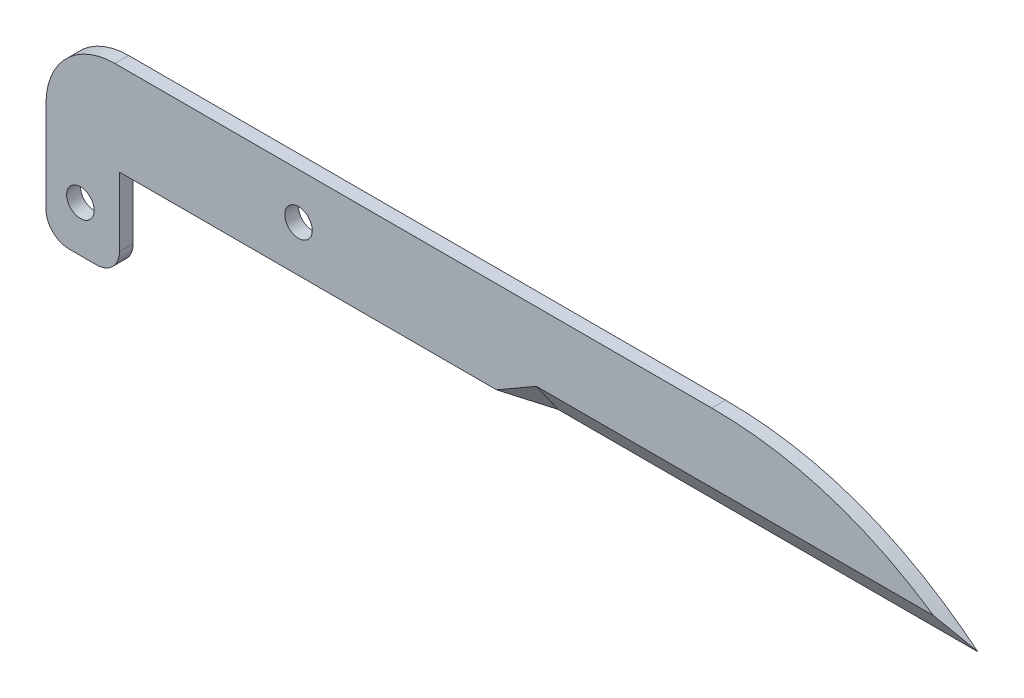
from build123d import *

# Parameters (mm, degrees)
SKETCH_1_W          = 200
SKETCH_1_H          = 20
EXTRUDE_1_DEPTH     = 3
CUT_EXTRUDE_1_REACH = 202.272
CHAMFER_1_SIZE      = 4
CHAMFER_1_SIZE_2    = 6.92820323
CUT_EXTRUDE_2_DEPTH = 101.543522914
SKETCH_5_R          = 3
CUT_EXTRUDE_3_DEPTH = 4
SKETCH_8_W          = 16
SKETCH_8_H          = 20
EXTRUDE_2_DEPTH     = 3
SKETCH_7_R          = 3
CUT_EXTRUDE_5_DEPTH = 10
FILLET_1_R          = 15
FILLET_2_R          = 5


with BuildPart() as part:
    # 草图1 → 凸台-拉伸1 (new body)
    with BuildSketch(Plane.XY):
        Rectangle(SKETCH_1_W, SKETCH_1_H)
    extrude(amount=EXTRUDE_1_DEPTH)

    # 切除-拉伸1: up to this plane
    cut_extrude_1_end = Plane(origin=(7.330127019, -12.696152423, 0), z_dir=(-0.49999999999999445, 0.8660254037844419, 0))
    # 草图3 → 切除-拉伸1 (cut, up to the surface)
    with BuildSketch(Plane(origin=(100, 0, 0), x_dir=(0, 0, -1), z_dir=(1, 0, 0)), mode=Mode.PRIVATE) as cut_extrude_1_sk1:
        Polygon((-3, -5), (0, -10), (-3, -10), align=None)
    cut_extrude_1_tool1 = split(extrude(cut_extrude_1_sk1.sketch, amount=-CUT_EXTRUDE_1_REACH, mode=Mode.PRIVATE), bisect_by=cut_extrude_1_end, keep=Keep.BOTH, mode=Mode.PRIVATE)
    add(cut_extrude_1_tool1.solids().sort_by_distance((100, -8.333333, 2))[0], mode=Mode.SUBTRACT)

    # 倒角1
    # the kernel refuses this chamfer: 6.92820323, 4 mm, written as the material it takes off along each edge
    with BuildSketch(Plane(origin=(-3.522514528, -18.961927941, 3), x_dir=(0.02894693120133512, -0.05013755556391397, -0.9983227437537926), z_dir=(0.8660254037844419, 0.49999999999999445, 0))) as chamfer_1_piece_1_section:
        Polygon((CHAMFER_1_SIZE * 0.998322743754, CHAMFER_1_SIZE * 0.0578938624027), (-CHAMFER_1_SIZE_2 * 0.057893862405, CHAMFER_1_SIZE_2 * 0.998322743793), (0, 0), align=None)
    chamfer_1_piece_1 = extrude(amount=45.847711765, mode=Mode.PRIVATE)
    chamfer_1_piece_1 = split(chamfer_1_piece_1, bisect_by=Plane(origin=(9.642486401, -7.716503268, 1.370098039), z_dir=(0, -0.5144957554275265, 0.8574929257125443)), keep=Keep.TOP, mode=Mode.PRIVATE)
    add(chamfer_1_piece_1, mode=Mode.SUBTRACT)

    # 草图4 → 切除-拉伸2 (cut, through all)
    with BuildSketch(Plane.XY.offset(3)):
        with BuildLine():
            Line((45, 10), (45, 14.118329336))
            Line((45, 14.118329336), (100, 14.118329336))
            Line((100, 14.118329336), (100, -10))
            add(Edge.make_bspline(
                [(100, -10), (75.292472647, 10), (45, 10)],
                knots=[0, 0, 0, 1, 1, 1], degree=2))
        make_face()
    extrude(amount=-CUT_EXTRUDE_2_DEPTH, mode=Mode.SUBTRACT)

    # 草图5 → 切除-拉伸3 (cut)
    with BuildSketch(Plane.XY.offset(3)):
        with Locations((-45, 0)):
            Circle(SKETCH_5_R)
    extrude(amount=-CUT_EXTRUDE_3_DEPTH, mode=Mode.SUBTRACT)

    # 草图8 → 凸台-拉伸2 (add)
    with BuildSketch(Plane.XY.offset(3)):
        with Locations((-92, -20)):
            Rectangle(SKETCH_8_W, SKETCH_8_H)
    extrude(amount=-EXTRUDE_2_DEPTH)

    # 草图7 → 切除-拉伸5 (cut)
    with BuildSketch(Plane.XY.offset(3)):
        with Locations((-92.5, -20)):
            Circle(SKETCH_7_R)
    extrude(amount=-CUT_EXTRUDE_5_DEPTH, mode=Mode.SUBTRACT)

    # 圆角1
    fillet_1_edges = [part.edges().sort_by_distance(p)[0] for p in [
        (-100, 10, 1.5),
    ]]
    fillet(fillet_1_edges, radius=FILLET_1_R)

    # 圆角2
    fillet_2_edges = [part.edges().sort_by_distance(p)[0] for p in [
        (-84, -30, 1.5),
        (-100, -30, 1.5),
    ]]
    fillet(fillet_2_edges, radius=FILLET_2_R)


solid = part.part
